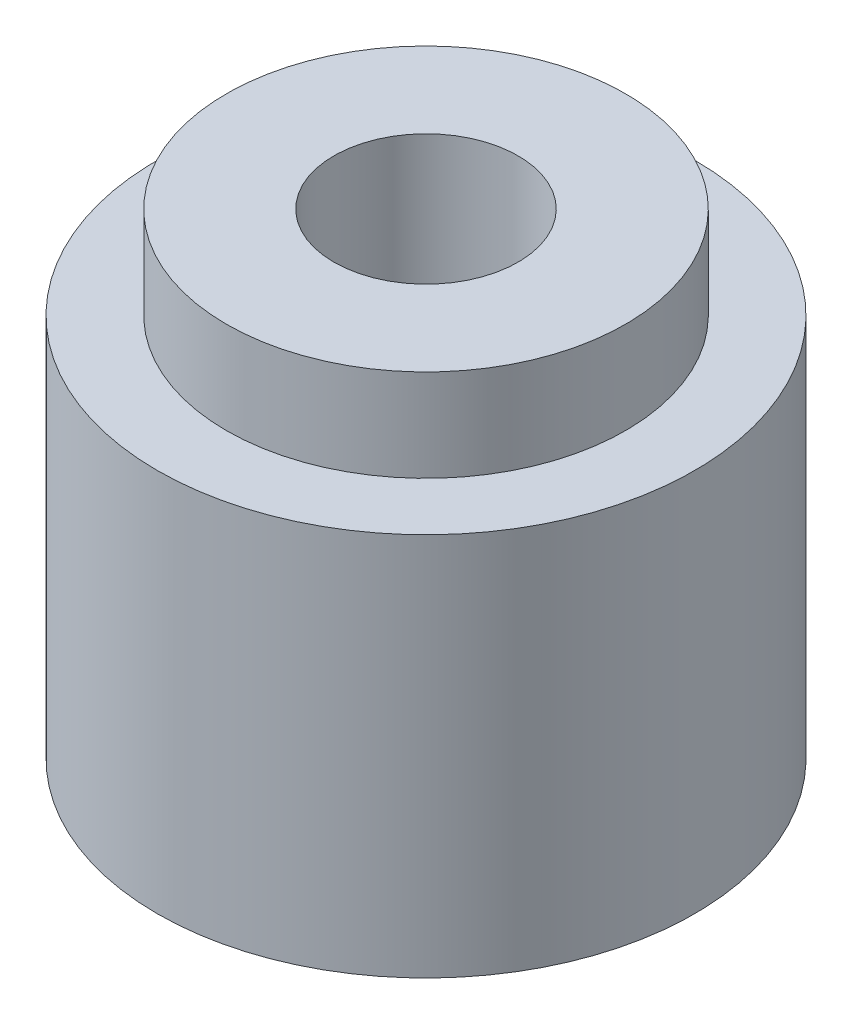
from build123d import *

# Parameters (mm, degrees)
SKETCH1_R           = 17.5
BOSS_EXTRUDE1_DEPTH = 25
SKETCH2_R           = 13
BOSS_EXTRUDE2_DEPTH = 6
SKETCH3_R           = 6
CUT_EXTRUDE1_DEPTH  = 40.667366941


with BuildPart() as part:
    # Sketch1 → Boss-Extrude1 (new body)
    with BuildSketch(Plane(origin=(0, 0, 0), x_dir=(1, 0, 0), z_dir=(0, 1, 0))):
        Circle(SKETCH1_R)
    extrude(amount=BOSS_EXTRUDE1_DEPTH)

    # Sketch2 → Boss-Extrude2 (add)
    with BuildSketch(Plane(origin=(0, 25, 0), x_dir=(1, 0, 0), z_dir=(0, 1, 0))):
        Circle(SKETCH2_R)
    extrude(amount=BOSS_EXTRUDE2_DEPTH)

    # Sketch3 → Cut-Extrude1 (cut, through all)
    with BuildSketch(Plane(origin=(0, 31, 0), x_dir=(1, 0, 0), z_dir=(0, 1, 0))):
        Circle(SKETCH3_R)
    extrude(amount=-CUT_EXTRUDE1_DEPTH, mode=Mode.SUBTRACT)


solid = part.part
